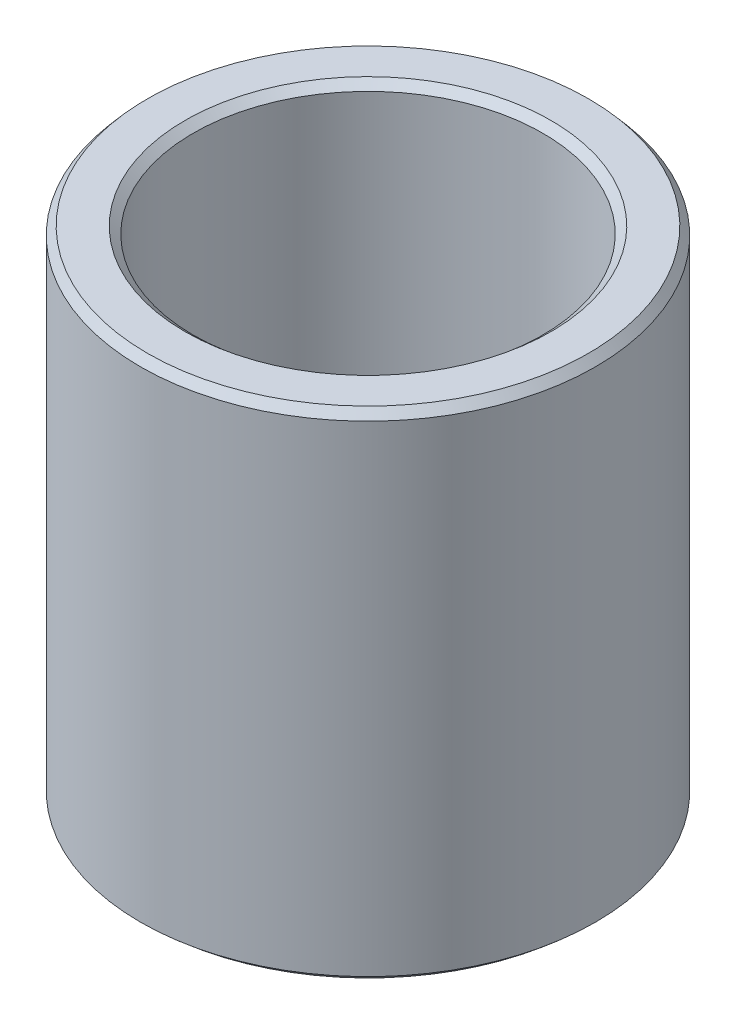
from build123d import *
from OCP.BRepFilletAPI import BRepFilletAPI_MakeChamfer

# Parameters (mm, degrees)
SKETCH1_R           = 20
BOSS_EXTRUDE1_DEPTH = 43.612281033
SKETCH2_R           = 15.367751224
CUT_EXTRUDE1_DEPTH  = 52.981064407
CHAMFER1_SIZE       = 0.717599944
CHAMFER1_SIZE2      = 0.614561306


with BuildPart() as part:
    # Sketch1 → Boss-Extrude1 (new body)
    with BuildSketch(Plane(origin=(0, 0, 0), x_dir=(1, 0, 0), z_dir=(0, 1, 0))):
        Circle(SKETCH1_R)
    extrude(amount=BOSS_EXTRUDE1_DEPTH)

    # Sketch2 → Cut-Extrude1 (cut, through all)
    with BuildSketch(Plane(origin=(0, 0, 0), x_dir=(1, 0, 0), z_dir=(0, 1, 0))):
        Circle(SKETCH2_R)
    extrude(amount=CUT_EXTRUDE1_DEPTH, mode=Mode.SUBTRACT)

    # Chamfer1: one chamfer whose edges measure the first distance from different faces: ONE call of the kernel's chamfer builder (chamfer() names one face for all edges)
    chamfer1_edges_1 = [part.edges().sort_by_distance(p)[0] for p in [
        (-15.367751224, 43.612281033, 0),
    ]]
    chamfer1_side_1 = [part.faces().sort_by_distance(p)[0] for p in [
        (-19.434314575, 43.612281033, 0),
    ]]
    chamfer1_edges_2 = [part.edges().sort_by_distance(p)[0] for p in [
        (-15.367751224, 0, 0),
    ]]
    chamfer1_side_2 = [part.faces().sort_by_distance(p)[0] for p in [
        (-15.367751224, 21.806140517, 0),
    ]]
    chamfer1_edges_3 = [part.edges().sort_by_distance(p)[0] for p in [
        (-20, 0, 0),
    ]]
    chamfer1_side_3 = [part.faces().sort_by_distance(p)[0] for p in [
        (-19.434314575, 0, 0),
    ]]
    chamfer1_edges_4 = [part.edges().sort_by_distance(p)[0] for p in [
        (-20, 43.612281033, 0),
    ]]
    chamfer1_side_4 = [part.faces().sort_by_distance(p)[0] for p in [
        (-20, 21.806140517, 0),
    ]]
    chamfer1 = BRepFilletAPI_MakeChamfer(part.part.solid().wrapped)
    for e in chamfer1_edges_1:
        chamfer1.Add(CHAMFER1_SIZE, CHAMFER1_SIZE2, e.wrapped, chamfer1_side_1[0].wrapped)  # the first distance lies on this face
    for e in chamfer1_edges_2:
        chamfer1.Add(CHAMFER1_SIZE, CHAMFER1_SIZE2, e.wrapped, chamfer1_side_2[0].wrapped)  # the first distance lies on this face
    for e in chamfer1_edges_3:
        chamfer1.Add(CHAMFER1_SIZE, CHAMFER1_SIZE2, e.wrapped, chamfer1_side_3[0].wrapped)  # the first distance lies on this face
    for e in chamfer1_edges_4:
        chamfer1.Add(CHAMFER1_SIZE, CHAMFER1_SIZE2, e.wrapped, chamfer1_side_4[0].wrapped)  # the first distance lies on this face
    add(Compound.cast(chamfer1.Shape()), mode=Mode.REPLACE)


solid = part.part
